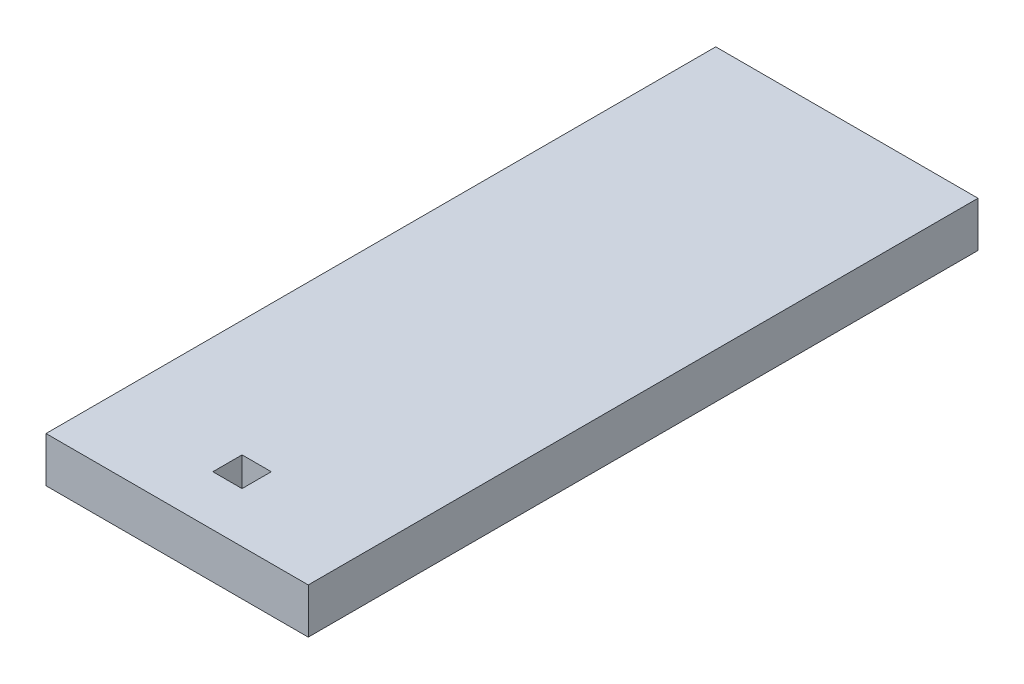
from build123d import *

# Parameters (mm, degrees)
SKETCH1_W           = 21.575
SKETCH1_H           = 46.99
SKETCH1_W_2         = 2.05
SKETCH1_H_2         = 2.05
BOSS_EXTRUDE1_DEPTH = 3.175
SKETCH2_W           = 3.175
SKETCH2_H           = 46.99
CUT_EXTRUDE1_DEPTH  = 27.743901641


with BuildPart() as part:
    # Sketch1 → Boss-Extrude1 (new body)
    with BuildSketch(Plane(origin=(0, 0, 0), x_dir=(1, 0, 0), z_dir=(0, 1, 0))):
        with Locations((-1.5875, 0)):
            Rectangle(SKETCH1_W, SKETCH1_H)
        with Locations((0, -18.93924342)):
            Rectangle(SKETCH1_W_2, SKETCH1_H_2, mode=Mode.SUBTRACT)
    extrude(amount=BOSS_EXTRUDE1_DEPTH)

    # Sketch2 → Cut-Extrude1 (cut, through all)
    with BuildSketch(Plane(origin=(0, 3.175, 0), x_dir=(1, 0, 0), z_dir=(0, 1, 0))):
        with Locations((-10.7875, 0)):
            Rectangle(SKETCH2_W, SKETCH2_H)
    extrude(amount=-CUT_EXTRUDE1_DEPTH, mode=Mode.SUBTRACT)


solid = part.part
